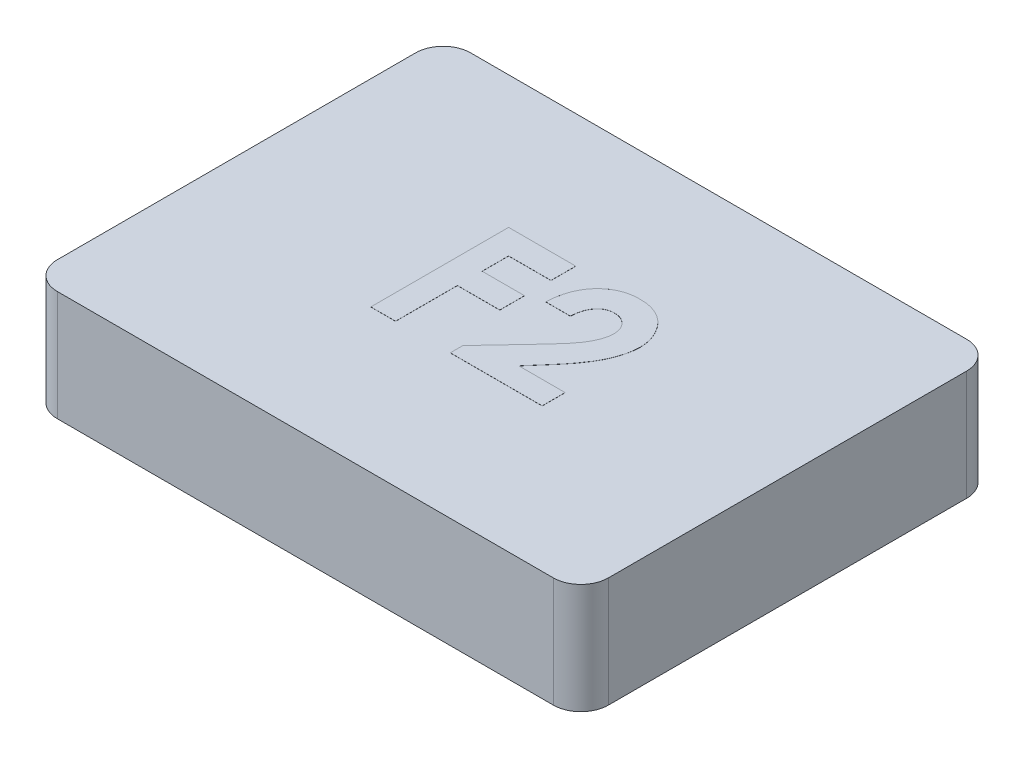
from build123d import *

# Parameters (mm, degrees)
SKETCH1_W           = 12.7
SKETCH1_H           = 9.525
BOSS_EXTRUDE1_DEPTH = 2.54
FILLET1_R           = 0.635
SHELL1_START        = 0.635
SHELL1_OUTLINE_W    = 1.905
SHELL1_OUTLINE_H    = 8.255
SHELL1_DEPTH        = 11.43
SKETCH2_R           = 2.54
BOSS_EXTRUDE2_DEPTH = 1.905
BOSS_EXTRUDE3_DEPTH = 0.00254


# Read off the part's stored shape, not the designer's step: Shell1
with BuildPart() as part:
    # Sketch1 → Boss-Extrude1 (new body)
    with BuildSketch(Plane(origin=(0, 0, 0), x_dir=(1, 0, 0), z_dir=(0, 1, 0))):
        with Locations((6.35, 4.7625)):
            Rectangle(SKETCH1_W, SKETCH1_H)
    extrude(amount=BOSS_EXTRUDE1_DEPTH)

    # Fillet1
    fillet1_edges = [part.edges().sort_by_distance(p)[0] for p in [
        (0, 1.27, -9.525),
        (12.7, 1.27, -9.525),
        (12.7, 1.27, 0),
        (0, 1.27, 0),
    ]]
    fillet(fillet1_edges, radius=FILLET1_R)

    # Shell1 outline → Shell1 (cut)
    with BuildSketch(Plane.YZ.offset(SHELL1_START)):
        with Locations((0.9525, -4.7625)):
            Rectangle(SHELL1_OUTLINE_W, SHELL1_OUTLINE_H)
    extrude(amount=SHELL1_DEPTH, mode=Mode.SUBTRACT)

    # Sketch2 → Boss-Extrude2 (add)
    with BuildSketch(Plane(origin=(0, 1.905, 0), x_dir=(-1, 0, 0), z_dir=(0, -1, 0))):
        with Locations(Location((-6.35, 4.7625, 0), (0, 0, 270))):
            Circle(SKETCH2_R)
    extrude(amount=BOSS_EXTRUDE2_DEPTH)

    # Sketch3 → Boss-Extrude3 (add)
    with BuildSketch(Plane(origin=(0, 2.54, 0), x_dir=(1, 0, 0), z_dir=(0, 1, 0))):
        Polygon((4.557346154, 6.477), (6.104141026, 6.477), (6.104141026, 5.907128205), (5.127217949, 5.907128205), (5.127217949, 5.296551282), (6.104141026, 5.296551282), (6.104141026, 4.726679487), (5.127217949, 4.726679487), (5.127217949, 3.302), (4.557346154, 3.302), align=None)
        with BuildLine():
            Line((7.040358974, 5.418666667), (6.470487179, 5.418666667))
            add(Edge.make_bspline(
                [(6.470487179, 5.418666667), (6.472948368, 5.461774453), (6.477757384, 5.54600448), (6.496886431, 5.66835129), (6.522518698, 5.783955572), (6.556728361, 5.89241293), (6.599715041, 5.993683952), (6.65037258, 6.088113879), (6.709995163, 6.175205533), (6.777313826, 6.254538911), (6.851185682, 6.325709616), (6.930077079, 6.388814034), (7.015194768, 6.440886212), (7.104983579, 6.483736794), (7.199428222, 6.517972417), (7.299422293, 6.540861702), (7.404099988, 6.55636255), (7.475760347, 6.557718936), (7.512284054, 6.558410256)],
                knots=[0, 0, 0, 0, 1.199038563, 2.342849363, 3.436047546, 4.486744587, 5.497670872, 6.488682221, 7.459191391, 8.424610317, 9.374430501, 10.305433194, 11.225809216, 12.140057399, 13.06607119, 14.010487599, 14.985989317, 16, 16, 16, 16], degree=3))
            add(Edge.make_bspline(
                [(7.512284054, 6.558410256), (7.557116388, 6.557011369), (7.644639608, 6.554280414), (7.77181779, 6.53098446), (7.890588306, 6.492018376), (8.000864822, 6.437572481), (8.101708535, 6.368404679), (8.193102721, 6.285933395), (8.272283476, 6.188428338), (8.339752827, 6.079946535), (8.395811794, 5.965079574), (8.435095583, 5.846302372), (8.460916395, 5.726766795), (8.463670345, 5.646277588), (8.465038462, 5.606291867)],
                knots=[0, 0, 0, 0, 1.075374347, 2.099382735, 3.09057751, 4.06680945, 5.040638231, 6.016817125, 7.011024321, 8.044445721, 9.0776792, 10.070479129, 11.0414456, 12, 12, 12, 12], degree=3))
            add(Edge.make_bspline(
                [(8.465038462, 5.606291867), (8.464505789, 5.582105677), (8.463433651, 5.53342485), (8.455978932, 5.459758812), (8.44479538, 5.384721339), (8.427933309, 5.308376769), (8.406904924, 5.230703702), (8.381394454, 5.151469689), (8.350810158, 5.071123958), (8.315662426, 4.98876223), (8.273731092, 4.904117111), (8.224907883, 4.815919737), (8.167896919, 4.724248345), (8.103386822, 4.62858533), (8.03106428, 4.529081566), (7.950576239, 4.426036789), (7.862849733, 4.319087904), (7.800587764, 4.247598577), (7.768599159, 4.210869191)],
                knots=[0, 0, 0, 0, 0.728284026, 1.46585585, 2.227944881, 3.01186502, 3.81876927, 4.650621989, 5.517437689, 6.406905708, 7.346299482, 8.360816762, 9.441613733, 10.596154504, 11.834900912, 13.145207542, 14.533280747, 16, 16, 16, 16], degree=3))
            Line((7.768599159, 4.210869191), (7.437233974, 3.831166667))
            Line((7.437233974, 3.831166667), (8.50574359, 3.831166667))
            Line((8.50574359, 3.831166667), (8.50574359, 3.302))
            Line((8.50574359, 3.302), (6.389076923, 3.302))
            Line((6.389076923, 3.302), (6.389076923, 3.590752003))
            Line((6.389076923, 3.590752003), (7.329110978, 4.591207732))
            add(Edge.make_bspline(
                [(7.329110978, 4.591207732), (7.356327379, 4.620391337), (7.409037478, 4.676911324), (7.484038516, 4.759916937), (7.551907831, 4.838687284), (7.611238096, 4.914061108), (7.665142888, 4.983593589), (7.711218596, 5.049380524), (7.749886777, 5.110827174), (7.791866571, 5.184921103), (7.831733577, 5.273291298), (7.868313967, 5.375097387), (7.890612246, 5.47240056), (7.893690114, 5.5358054), (7.895166667, 5.566222756)],
                knots=[0, 0, 0, 0, 1.246127091, 2.413378631, 3.493388633, 4.492180848, 5.408488754, 6.240484944, 6.999099869, 7.674939598, 8.898438119, 10.020720584, 11.050475521, 12, 12, 12, 12], degree=3))
            add(Edge.make_bspline(
                [(7.895166667, 5.566222756), (7.894062684, 5.595649202), (7.89192354, 5.652667658), (7.868416082, 5.733776109), (7.831997512, 5.807211531), (7.780678605, 5.870779591), (7.718515335, 5.923017682), (7.646679837, 5.961870906), (7.565757782, 5.984289038), (7.50902988, 5.987094988), (7.479847155, 5.988538462)],
                knots=[0, 0, 0, 0, 1.062038974, 2.057870785, 3.028805853, 4.01125022, 4.991535629, 5.949134679, 6.94496649, 8, 8, 8, 8], degree=3))
            add(Edge.make_bspline(
                [(7.479847155, 5.988538462), (7.464770988, 5.988005225), (7.435091132, 5.986955463), (7.391464063, 5.979967483), (7.349949772, 5.967651898), (7.310086183, 5.951150747), (7.27229873, 5.929278353), (7.236682725, 5.902317143), (7.202862908, 5.870952262), (7.170994391, 5.835281784), (7.14198988, 5.79547352), (7.116228179, 5.751891037), (7.094927542, 5.704561389), (7.076173686, 5.654109398), (7.061709815, 5.59999317), (7.051178323, 5.542536583), (7.043171933, 5.481833113), (7.041313685, 5.440105185), (7.040358974, 5.418666667)],
                knots=[0, 0, 0, 0, 0.903469896, 1.778625579, 2.63899355, 3.493148037, 4.358286772, 5.247621495, 6.164656832, 7.118446693, 8.109501108, 9.111810964, 10.146451449, 11.215617525, 12.33435995, 13.498009769, 14.714554818, 16, 16, 16, 16], degree=3))
        make_face()
    extrude(amount=BOSS_EXTRUDE3_DEPTH)


solid = part.part
